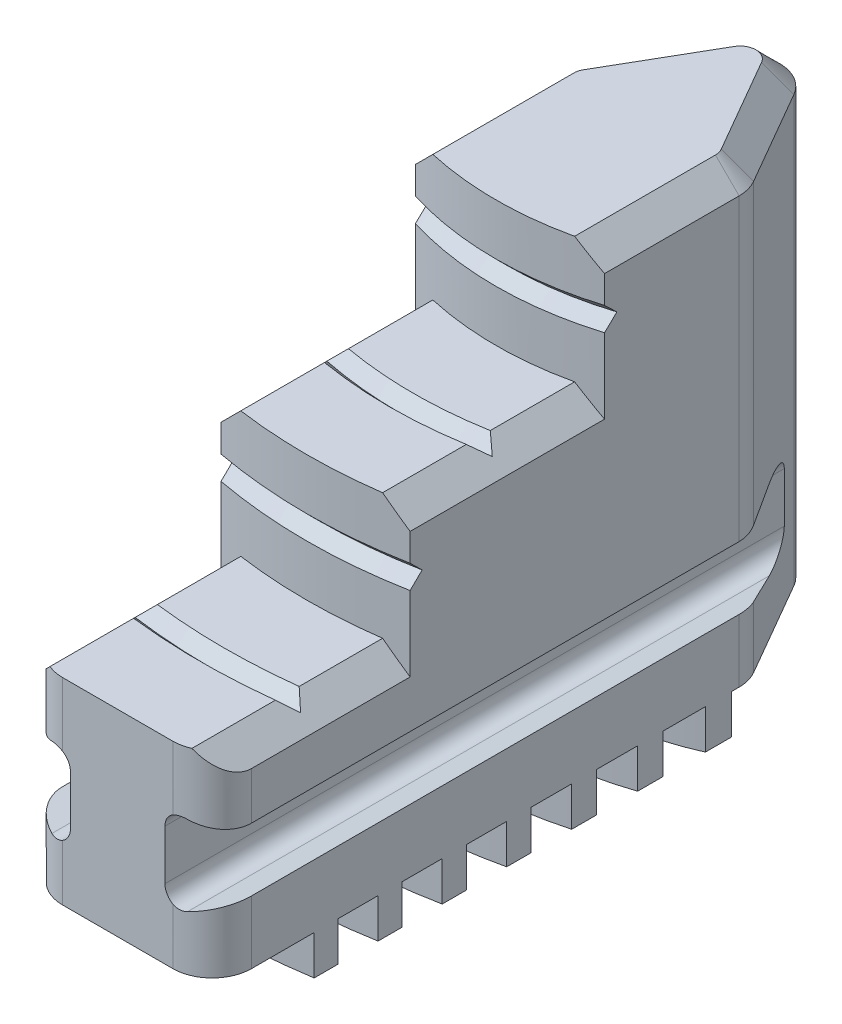
from build123d import *

# Parameters (mm, degrees)
BOSS_EXTRUDE1_DEPTH     = 62
SKETCH2_W               = 5
SKETCH2_H               = 5
SKETCH2_W_2             = 21
SKETCH2_W_3             = 24
CUT_EXTRUDE1_DEPTH      = 106.090437243
CUT_EXTRUDE1_DEPTH_BACK = 106.090437243
CHAMFER2_SIZE           = 3


with BuildPart() as part:
    # Sketch1 → Boss-Extrude1 (new body)
    with BuildSketch(Plane(origin=(0, 0, 0), x_dir=(1, 0, 0), z_dir=(0, 1, 0))):
        with BuildLine():
            Line((12, 5), (12, 66.875644347))
            ThreePointArc((12, 66.875644347), (11.829629131, 68.169739573), (11.330127019, 69.375644347))
            Line((11.330127019, 69.375644347), (4.330127019, 81.5))
            ThreePointArc((4.330127019, 81.5), (0, 84), (-4.330127019, 81.5))
            Line((-4.330127019, 81.5), (-11.330127019, 69.375644347))
            ThreePointArc((-11.330127019, 69.375644347), (-11.829629131, 68.169739573), (-12, 66.875644347))
            Line((-12, 66.875644347), (-12, 5))
            ThreePointArc((-12, 5), (-10.535533906, 1.464466094), (-7, 0))
            Line((-7, 0), (7, 0))
            ThreePointArc((7, 0), (10.535533906, 1.464466094), (12, 5))
        make_face()
    extrude(amount=BOSS_EXTRUDE1_DEPTH)

    # Sketch2 → Cut-Revolve2 (revolve, cut)
    with BuildSketch(Plane(origin=(0, 0, 0), x_dir=(0, 0, -1), z_dir=(1, 0, 0))):
        Polygon((48, 55.5), (48, 62), (-12, 62), (-12, 30), (10.5, 30), (12, 28.5), (13.5, 30), (24, 30), (24, 36.5), (25.5, 38), (24, 39.5), (24, 46), (34.5, 46), (36, 44.5), (37.5, 46), (48, 46), (48, 52.5), (49.5, 54), align=None)
        with Locations((17.5, 2.5)):
            Rectangle(SKETCH2_W, SKETCH2_H)
        with Locations((25.5, 2.5)):
            Rectangle(SKETCH2_W, SKETCH2_H)
        with Locations((33.5, 2.5)):
            Rectangle(SKETCH2_W, SKETCH2_H)
        with Locations((41.5, 2.5)):
            Rectangle(SKETCH2_W, SKETCH2_H)
        with Locations((49.5, 2.5)):
            Rectangle(SKETCH2_W, SKETCH2_H)
        with Locations((57.5, 2.5)):
            Rectangle(SKETCH2_W, SKETCH2_H)
        with Locations((73.5, 2.5)):
            Rectangle(SKETCH2_W_2, SKETCH2_H)
        with Locations((0, 2.5)):
            Rectangle(SKETCH2_W_3, SKETCH2_H)
    revolve(axis=Axis((0, 62, -89), (0, -1, 0)), mode=Mode.SUBTRACT)

    # Sketch3 → Cut-Extrude1 (cut, two sides: drawn at the far end of the back side and taken through both)
    with BuildSketch(Plane.XY.offset(-CUT_EXTRUDE1_DEPTH_BACK)):
        with BuildLine():
            Line((-12, 21), (-8.601411599, 22.071570807))
            ThreePointArc((-8.601411599, 22.071570807), (-6.817380703, 21.777026114), (-6, 20.164136905))
            Line((-6, 20.164136905), (-6, 17))
            Line((-6, 17), (-6, 13.835863095))
            ThreePointArc((-6, 13.835863095), (-6.817380703, 12.222973886), (-8.601411599, 11.928429193))
            Line((-8.601411599, 11.928429193), (-12, 13))
            Line((-12, 13), (-12, 17))
            Line((-12, 17), (-12, 21))
        make_face()
        with BuildLine():
            Line((12, 13), (8.601411599, 11.928429193))
            ThreePointArc((8.601411599, 11.928429193), (6.817380703, 12.222973886), (6, 13.835863095))
            Line((6, 13.835863095), (6, 17))
            Line((6, 17), (6, 20.164136905))
            ThreePointArc((6, 20.164136905), (6.817380703, 21.777026114), (8.601411599, 22.071570807))
            Line((8.601411599, 22.071570807), (12, 21))
            Line((12, 21), (12, 17))
            Line((12, 17), (12, 13))
        make_face()
    extrude(amount=CUT_EXTRUDE1_DEPTH + CUT_EXTRUDE1_DEPTH_BACK, mode=Mode.SUBTRACT)

    # Chamfer2
    # the kernel refuses this chamfer: 3 mm, written as the material it takes off along each edge
    with BuildSketch(Plane(origin=(7, 62, -66.875644347), x_dir=(1, 0, 0), z_dir=(0, 0, 1))) as chamfer2_piece_1:
        Polygon((5 - CHAMFER2_SIZE, 0), (5, -CHAMFER2_SIZE), (5, 0), align=None)
    revolve(axis=Axis((7, 62, -66.875644347), (0, 1, 0)), revolution_arc=30, mode=Mode.SUBTRACT)
    with BuildSketch(Plane(origin=(11.330127019, 62, -69.375644347), x_dir=(0.02381212764408926, -0.9996219169112969, -0.01374793830529249), z_dir=(-0.4999999999999953, 0, -0.8660254037844414)), Plane(origin=(-4.330127019, 62, -81.5), x_dir=(-0.023812127644089475, -0.9996219169112969, -0.013747938305292619), z_dir=(-0.49999999999999545, 0, 0.8660254037844414))) as chamfer2_piece_2:
        Polygon((CHAMFER2_SIZE * 0.999621916911, CHAMFER2_SIZE * 0.0274958766106), (-CHAMFER2_SIZE * 0.0274958766106, CHAMFER2_SIZE * 0.999621916911), (0, 0), align=None)
    extrude(amount=14, mode=Mode.SUBTRACT)
    with BuildSketch(Plane(origin=(0, 62, -79), x_dir=(0.8660254037844419, 0, -0.49999999999999434), z_dir=(0.49999999999999434, 0, 0.8660254037844419))) as chamfer2_piece_3:
        Polygon((5, -CHAMFER2_SIZE), (5 - CHAMFER2_SIZE, 0), (5, 0), align=None)
    revolve(axis=Axis((0, 62, -79), (0, 1, 0)), revolution_arc=120, mode=Mode.SUBTRACT)
    with BuildSketch(Plane(origin=(-7, 62, -66.875644347), x_dir=(-0.8660254037844416, 0, -0.49999999999999484), z_dir=(0.49999999999999484, 0, -0.8660254037844416))) as chamfer2_piece_4:
        Polygon((5 - CHAMFER2_SIZE, 0), (5, -CHAMFER2_SIZE), (5, 0), align=None)
    revolve(axis=Axis((-7, 62, -66.875644347), (0, 1, 0)), revolution_arc=30, mode=Mode.SUBTRACT)
    with BuildSketch(Plane(origin=(-12, 62, -66.875644347), x_dir=(-0.02749587661058619, -0.9996219169112968, 0), z_dir=(0, 0, 1)), Plane(origin=(12, 62, -42.080359468), x_dir=(0.02749587661058619, -0.9996219169112968, 0), z_dir=(0, 0, -1))) as chamfer2_piece_5:
        Polygon((CHAMFER2_SIZE * 0.999621916911, CHAMFER2_SIZE * 0.0274958766106), (-CHAMFER2_SIZE * 0.0274958766106, CHAMFER2_SIZE * 0.999621916911), (0, 0), align=None)
    extrude(amount=24.795284879, mode=Mode.SUBTRACT)
    with BuildSketch(Plane(origin=(-12, 46, -17.402246021), x_dir=(-0.02749587661058619, -0.9996219169112968, 0), z_dir=(0, 0, -1)), Plane(origin=(12, 46, -43.55256219), x_dir=(0.02749587661058619, -0.9996219169112968, 0), z_dir=(0, 0, 1))) as chamfer2_piece_6:
        Polygon((CHAMFER2_SIZE * 0.999621916911, -CHAMFER2_SIZE * 0.0274958766106), (-CHAMFER2_SIZE * 0.0274958766106, -CHAMFER2_SIZE * 0.999621916911), (0, 0), align=None)
    extrude(amount=26.150316168, mode=Mode.SUBTRACT)
    with BuildSketch(Plane(origin=(-12, 30, -6.744693457), x_dir=(-0.02749587661058619, -0.9996219169112968, 0), z_dir=(0, 0, -1))) as chamfer2_piece_7_section:
        Polygon((CHAMFER2_SIZE * 0.999621916911, -CHAMFER2_SIZE * 0.0274958766106), (-CHAMFER2_SIZE * 0.0274958766106, -CHAMFER2_SIZE * 0.999621916911), (0, 0), align=None)
    chamfer2_piece_7 = extrude(amount=26.087650492, mode=Mode.PRIVATE)
    chamfer2_piece_7 = chamfer2_piece_7 - Plane(origin=(0, 28.957588125, -89), x_dir=(0, 0, 1), z_dir=(0, 1, 0)) * Cylinder(65, 65, mode=Mode.PRIVATE)
    add(chamfer2_piece_7, mode=Mode.SUBTRACT)
    with BuildSketch(Plane(origin=(-12, 46, -31.202518987), x_dir=(-0.02749587661058619, -0.9996219169112968, 0), z_dir=(0, 0, -1))) as chamfer2_piece_8_section:
        Polygon((CHAMFER2_SIZE * 0.999621916911, -CHAMFER2_SIZE * 0.0274958766106), (-CHAMFER2_SIZE * 0.0274958766106, -CHAMFER2_SIZE * 0.999621916911), (0, 0), align=None)
    chamfer2_piece_8 = extrude(amount=26.30793841, mode=Mode.PRIVATE)
    chamfer2_piece_8 = chamfer2_piece_8 - Plane(origin=(0, 44.953246724, -89), x_dir=(0, 0, 1), z_dir=(0, 1, 0)) * Cylinder(41, 65, mode=Mode.PRIVATE)
    add(chamfer2_piece_8, mode=Mode.SUBTRACT)
    with BuildSketch(Plane(origin=(12, 46, -57.510457396), x_dir=(0.02749587661058619, -0.9996219169112968, 0), z_dir=(0, 0, 1))) as chamfer2_piece_9_section:
        Polygon((CHAMFER2_SIZE * 0.999621916911, -CHAMFER2_SIZE * 0.0274958766106), (-CHAMFER2_SIZE * 0.0274958766106, -CHAMFER2_SIZE * 0.999621916911), (0, 0), align=None)
    chamfer2_piece_9 = extrude(amount=26.30793841, mode=Mode.PRIVATE)
    chamfer2_piece_9 = chamfer2_piece_9 - Plane(origin=(0, 44.982123039, -89), x_dir=(0, 0, 1), z_dir=(0, 1, 0)) * Cylinder(41, 65, mode=Mode.PRIVATE)
    add(chamfer2_piece_9, mode=Mode.SUBTRACT)
    with BuildSketch(Plane(origin=(12, 30, -32.832343949), x_dir=(0.02749587661058619, -0.9996219169112968, 0), z_dir=(0, 0, 1))) as chamfer2_piece_10_section:
        Polygon((CHAMFER2_SIZE * 0.999621916911, -CHAMFER2_SIZE * 0.0274958766106), (-CHAMFER2_SIZE * 0.0274958766106, -CHAMFER2_SIZE * 0.999621916911), (0, 0), align=None)
    chamfer2_piece_10 = extrude(amount=26.087650492, mode=Mode.PRIVATE)
    chamfer2_piece_10 = chamfer2_piece_10 - Plane(origin=(0, 28.982814192, -89), x_dir=(0, 0, 1), z_dir=(0, 1, 0)) * Cylinder(65, 65, mode=Mode.PRIVATE)
    add(chamfer2_piece_10, mode=Mode.SUBTRACT)
    with BuildSketch(Plane(origin=(12, 30, -19.13766824), x_dir=(-0.9996219169112968, 0.02749587661058678, 0), z_dir=(0, 0, 1)), Plane(origin=(-12, 30, 2.715048964), x_dir=(0.9996219169112968, 0.02749587661058678, 0), z_dir=(0, 0, -1))) as chamfer2_piece_11:
        Polygon((CHAMFER2_SIZE * 0.999621916911, CHAMFER2_SIZE * 0.0274958766106), (-CHAMFER2_SIZE * 0.0274958766106, CHAMFER2_SIZE * 0.999621916911), (0, 0), align=None)
    extrude(amount=21.852717204, mode=Mode.SUBTRACT)


solid = part.part
